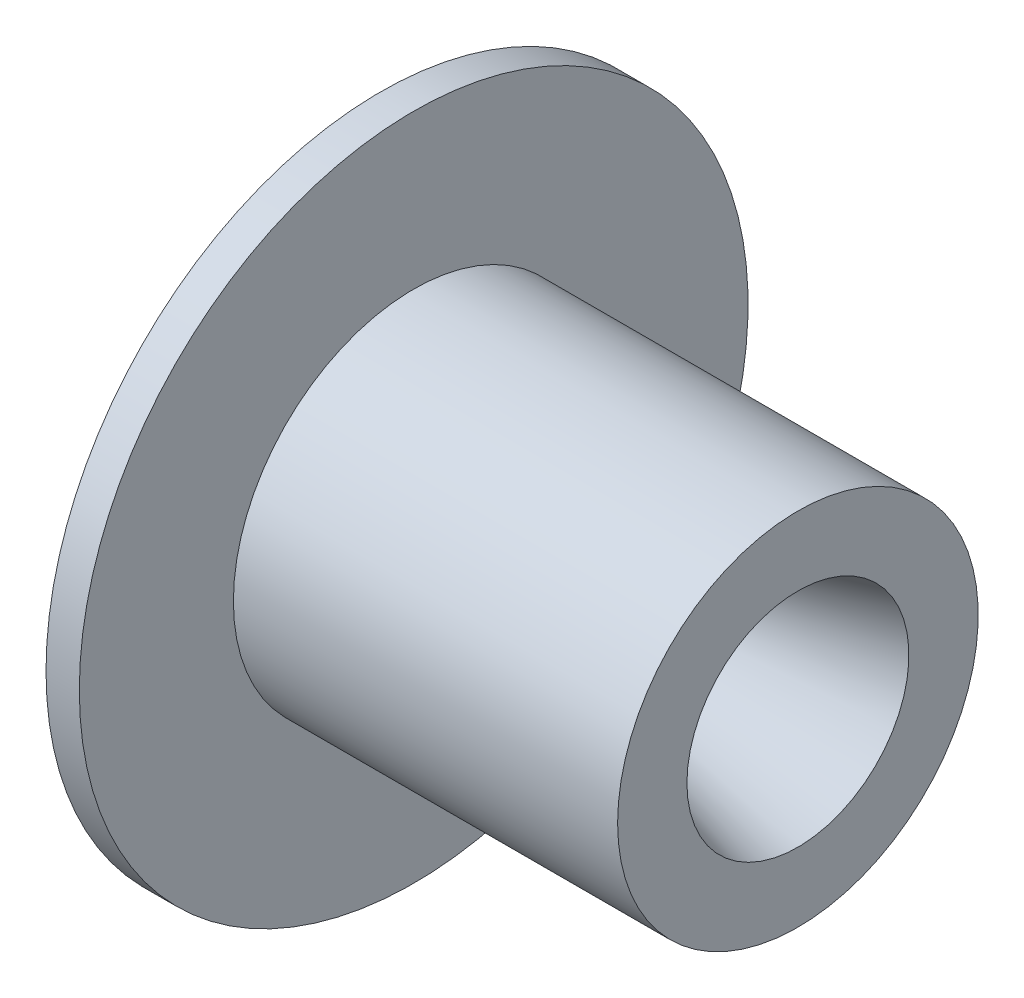
from build123d import *

# Parameters (mm, degrees)
RAO_INLET_RADIUS_R  = 20.8
RAO_OUTLET_RADIUS_R = 5.306744


with BuildPart() as part:
    # Sketch1 → Nozzle (revolve)
    with BuildSketch(Plane.XY):
        Polygon((-4.353201061, 9.421166631), (2.067370006, 9.421166631), (39.328165269, 19.405166631), (39.328165269, 29.975166631), (-19.273201061, 29.975166631), (-19.273201061, 53.475166631), (-24.353201061, 53.475166631), (-24.353201061, 27.875166631), align=None)
    revolve(axis=Axis((-40.101785961, 2.475166631, 0), (1, 0, 0)))

    # Rao inlet radius
    rao_inlet_radius_edges = [part.edges().sort_by_distance(p)[0] for p in [
        (2.067370006, -4.470833369, 0),
    ]]
    fillet(rao_inlet_radius_edges, radius=RAO_INLET_RADIUS_R)

    # Rao outlet radius
    rao_outlet_radius_edges = [part.edges().sort_by_distance(p)[0] for p in [
        (-4.353201061, -4.470833369, 0),
    ]]
    fillet(rao_outlet_radius_edges, radius=RAO_OUTLET_RADIUS_R)


solid = part.part
